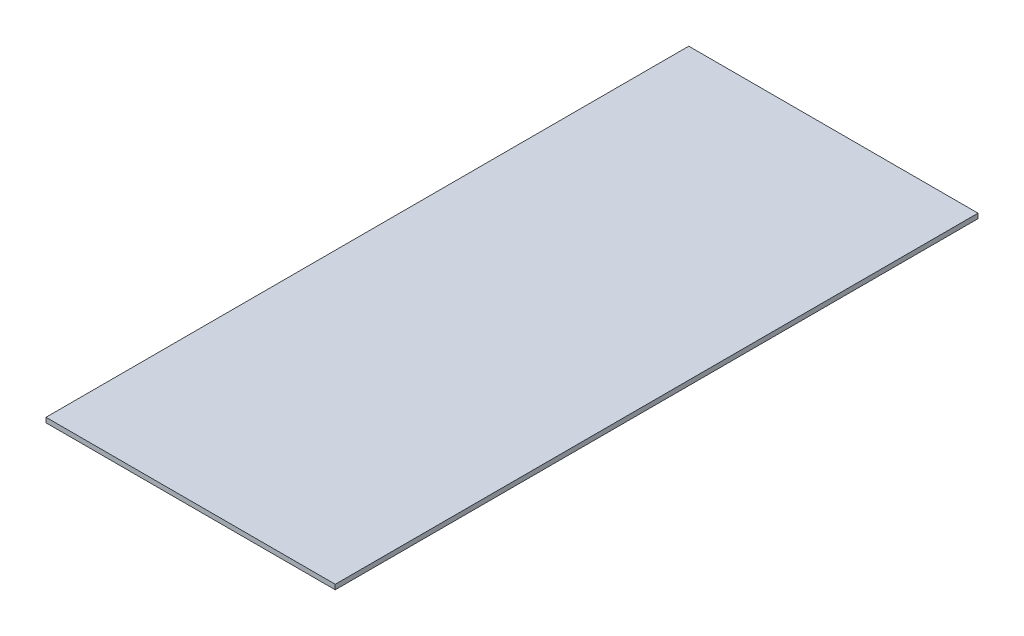
from build123d import *

# Parameters (mm, degrees)
SKETCH1_W           = 180
SKETCH1_H           = 400
BOSS_EXTRUDE1_DEPTH = 3


with BuildPart() as part:
    # Sketch1 → Boss-Extrude1 (new body)
    with BuildSketch(Plane(origin=(0, 0, 0), x_dir=(1, 0, 0), z_dir=(0, 1, 0))):
        with Locations((90, 200)):
            Rectangle(SKETCH1_W, SKETCH1_H)
    extrude(amount=BOSS_EXTRUDE1_DEPTH)


solid = part.part
